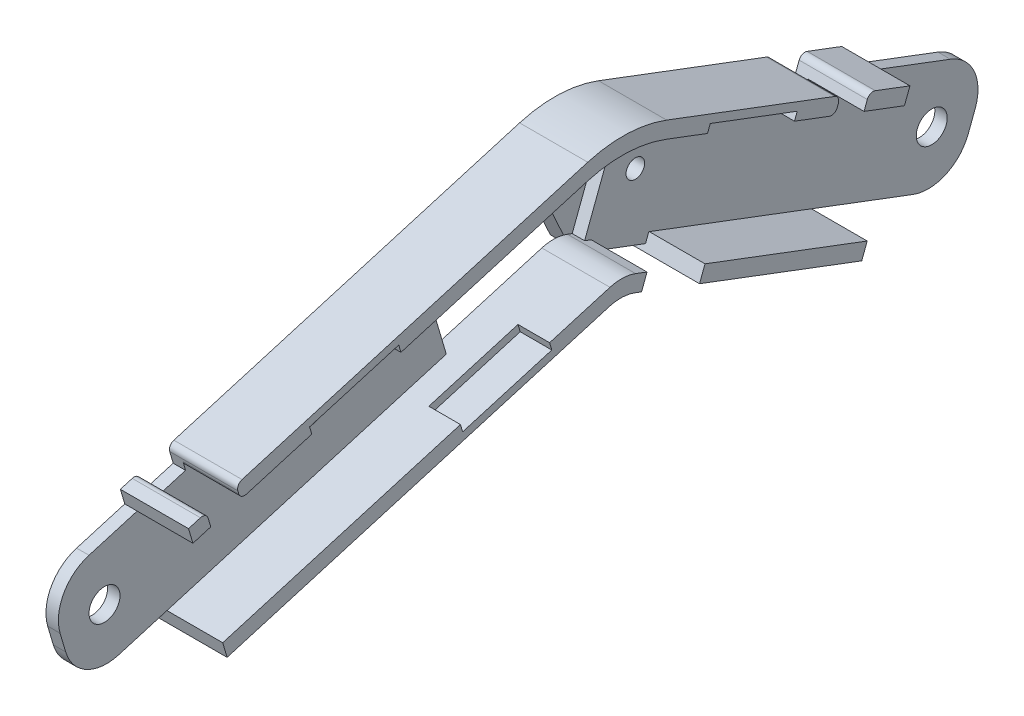
from build123d import *

# Parameters (mm, degrees)
SWEEP1_PROFILE_R        = 11
CUT_EXTRUDE1_DEPTH      = 139.5211963076765
CUT_EXTRUDE1_DEPTH_BACK = 139.5211963076765
BOSS_EXTRUDE1_DEPTH     = 11
BOSS_EXTRUDE4_DEPTH     = 11
SHELL1_START            = -11
SHELL1_DEPTH            = 11
SHELL1_START_2          = -113.150665538
SHELL1_2_DEPTH          = 47.855548818
SHELL1_START_3          = 20.420083618
SHELL1_3_DEPTH          = 73.048431747
FILLET1_R               = 6.5
BOSS_EXTRUDE2_DEPTH     = 3
CUT_EXTRUDE2_DEPTH      = 13.000000000000002
SKETCH21_R              = 2.499999999999935
SKETCH21_R_2            = 2.499999999999995
BOSS_EXTRUDE3_DEPTH     = 2
SKETCH22_R              = 1.4999999999999973
SKETCH22_R_2            = 1.5000000000000042
CUT_EXTRUDE3_DEPTH      = 13.000000000000002
FILLET2_R               = 3.75
CUT_EXTRUDE4_DEPTH      = 3
FILLET3_R               = 20
CUT_EXTRUDE5_DEPTH      = 3
FILLET4_R               = 1
CUT_EXTRUDE6_DEPTH      = 158.49217492446147
CUT_EXTRUDE7_DEPTH      = 5.1


with BuildPart() as part:
    # Sweep1: sweep along a path in Sketch6
    with BuildLine(Plane(origin=(0, 0, 0), x_dir=(0, 0, -1), z_dir=(1, 0, 0))) as sweep1_path:
        Line((17.67333262983066, 12.262734264551655), (84.99999999999999, 32.11621443102775))
        Line((84.99999999999999, 32.11621443102775), (127.09238599616681, 16.202979651458282))
    # Sweep1 profile (on start of the path) → Sweep1 (sweep)
    with BuildSketch(Plane(origin=(0, 12.262734264551655, -17.67333262983066), x_dir=(0, -0.9591665787285488, -0.28284178306991825), z_dir=(0, 0.28284178306991825, -0.9591665787285488))):
        Circle(SWEEP1_PROFILE_R)
    sweep(path=sweep1_path.line, transition=Transition.RIGHT)

    # Sketch13 → Cut-Extrude1 (cut, two sides: drawn at the far end of the back side and taken through both)
    with BuildSketch(Plane(origin=(0, 0, 0), x_dir=(1, 0, 0), z_dir=(0, 1, 0)).offset(-CUT_EXTRUDE1_DEPTH_BACK)):
        Polygon((-1.735e-14, 141.7207506217034), (-10.000000000000018, 141.7207506217034), (-10, -2.41e-15), (0, -1.18e-15), align=None)
    extrude(amount=CUT_EXTRUDE1_DEPTH + CUT_EXTRUDE1_DEPTH_BACK, mode=Mode.SUBTRACT)


with BuildPart() as cut_extrude1_piece_1:
    # of the separate pieces the step leaves, piece 1, a body of its own (cut_extrude1_pieces)
    add(part.part.solids().sort_by_distance((0, 22.813566631, -14.562073016))[0])



with BuildPart() as cut_extrude1_piece_2:
    # of the separate pieces the step leaves, piece 2, a body of its own (cut_extrude1_pieces)
    add(part.part.solids().sort_by_distance((-10, 7.867280813, -18.96947651))[0])


with BuildPart() as cut_extrude1_piece_1_1:
    add(cut_extrude1_piece_1.part)

    add(cut_extrude1_piece_2.part)  # Boss-Extrude1 merges Cut-Extrude1 piece 2
    # Sketch17 → Boss-Extrude1 (add)
    with BuildSketch(Plane(origin=(0, 0, 0), x_dir=(0, 0, -1), z_dir=(1, 0, 0))):
        Polygon((14.562073016061587, 22.813566630565735), (85.43326002077312, 43.71226488094253), (130.98228783117273, 26.4922295616324), (123.20248416116098, 5.91372974128417), (84.56673997922682, 20.52016398111302), (20.78459224359979, 1.7119018985376593), align=None)
    extrude(amount=-BOSS_EXTRUDE1_DEPTH)

    # Sketch24 → Boss-Extrude4 (add)
    with BuildSketch(Plane(origin=(0, 0, 0), x_dir=(0, 0, -1), z_dir=(1, 0, 0))):
        Polygon((127.09238599616687, 16.20297965145829), (84.99999999999997, 32.11621443102777), (17.673332629830696, 12.2627342645517), (14.5620730160616, 22.813566630565738), (85.43326002077312, 43.71226488094253), (130.98228783117273, 26.4922295616324), align=None)
    extrude(amount=BOSS_EXTRUDE4_DEPTH)

    # Shell1: read off the stored shape, not the designer's step
    # Shell1 outline → Shell1 (cut)
    with BuildSketch(Plane.YZ.offset(SHELL1_START)):
        Polygon((4.109818345, -20.077487786), (23.155629992, -84.665208166), (8.25219563, -124.08655276), (24.153763673, -130.098219232), (41.07679887, -85.334791834), (20.415650184, -15.269177474), align=None)
    extrude(amount=SHELL1_DEPTH, mode=Mode.SUBTRACT)

    # Shell1 2 outline → Shell1 2 (cut)
    with BuildSketch(Plane(origin=(0, 0, 0), x_dir=(1, 0, 0), z_dir=(0, 0.353627439545988, 0.935386355470374)).offset(SHELL1_START_2)):
        with BuildLine():
            ThreePointArc((0, 51.59940113), (6.01040764, 54.088993489), (8.5, 60.09940113))
            Line((8.5, 60.09940113), (8.5, 68.59940113))
            Line((8.5, 68.59940113), (0, 68.59940113))
            Line((0, 68.59940113), (0, 51.59940113))
        make_face()
    extrude(amount=SHELL1_2_DEPTH, mode=Mode.SUBTRACT)

    # Shell1 3 outline → Shell1 3 (cut)
    with BuildSketch(Plane(origin=(0, 0, 0), x_dir=(1, 0, 0), z_dir=(0, 0.2828417830699179, -0.9591665787285488)).offset(SHELL1_START_3)):
        with BuildLine():
            Line((8.5, -15.263247957), (8.5, -6.763247957))
            ThreePointArc((8.5, -6.763247957), (6.01040764, -0.752840317), (0, 1.736752043))
            Line((0, 1.736752043), (0, -15.263247957))
            Line((0, -15.263247957), (8.5, -15.263247957))
        make_face()
    extrude(amount=SHELL1_3_DEPTH, mode=Mode.SUBTRACT)

    # Fillet1
    fillet1_edges = [cut_extrude1_piece_1_1.edges().sort_by_distance(p)[0] for p in [
        (7.881335387835811, 24.026781093815067, -84.69775674305134),
        (6.090122796410721, 25.865288676138242, -84.76644839135132),
        (-5.5, 23.155629992, -84.665208166),
        (-5.5, 20.52016398111302, -84.56673997922682),
    ]]
    fillet(fillet1_edges, radius=FILLET1_R)

    # Sketch19 → Boss-Extrude2 (add)
    with BuildSketch(Plane(origin=(-11, 0, 0), x_dir=(0, 0, -1), z_dir=(1, 0, 0))):
        Polygon((23.326841994418306, 17.839501416273155), (61.69350514356026, 29.153172739069877), (63.814818516584644, 21.959423398605768), (25.44815536744269, 10.645752075809039), align=None)
        with BuildLine():
            Line((82.27394375020691, 30.863769892150234), (86.9487114072542, 20.688724856427108))
            Line((86.9487114072542, 20.688724856427108), (97.3098397387939, 16.771649028602706))
            Line((97.3098397387939, 16.771649028602706), (109.44211139391379, 26.082981771484846))
            Line((109.44211139391379, 26.082981771484846), (86.06088152658778, 34.92237140237257))
            ThreePointArc((86.06088152658778, 34.92237140237257), (82.80654161714303, 34.162852377504095), (82.27394375020691, 30.863769892150234))
        make_face()
    extrude(amount=-BOSS_EXTRUDE2_DEPTH)


with BuildPart() as boss_extrude2_piece_1:
    # of the separate pieces the step leaves, piece 1, a body of its own (boss_extrude2_pieces)
    add(cut_extrude1_piece_1_1.part.solids().sort_by_distance((-1e-09, 22.538001125, -82.570719291))[0])

    # Sketch20 → Cut-Extrude2 (cut)
    with BuildSketch(Plane(origin=(0, 45.92690987835062, -17.362895504685262), x_dir=(1, 0, 0), z_dir=(0, -0.9353863554703739, 0.3536274395459883))):
        Polygon((-11.00000000000001, -75.16519001409192), (3.999999999999988, -75.16519001409192), (3.9999999999999916, -85.1651900140919), (-11.00000000000001, -85.1651900140919), align=None)
    extrude(amount=-CUT_EXTRUDE2_DEPTH, mode=Mode.SUBTRACT)



with BuildPart() as boss_extrude2_piece_2:
    # of the separate pieces the step leaves, piece 2, a body of its own (boss_extrude2_pieces)
    add(cut_extrude1_piece_1_1.part.solids().sort_by_distance((-11, 17.839501416, -23.326841994))[0])


with BuildPart() as boss_extrude2_piece_1_1:
    add(boss_extrude2_piece_1.part)

    add(boss_extrude2_piece_2.part)  # Boss-Extrude3 merges Boss-Extrude2 piece 2
    # Sketch21 → Boss-Extrude3 (add)
    # profile 1 of 2: a face of its own
    with BuildSketch(Plane.ZY.offset(11)):
        with BuildLine():
            Line((-59.92574399937327, 35.14796385612329), (-14.844914799131477, 21.85440005183715))
            Line((-14.844914799131477, 21.85440005183715), (-15.269177473736278, 20.4156501837443))
            Line((-15.269177473736278, 20.4156501837443), (-7.49992818603503, 18.124631740877966))
            ThreePointArc((-7.49992818603503, 18.124631740877966), (-3.391731998282636, 14.806195907785265), (-2.833287095990472, 9.554774044468546))
            Line((-2.833287095990472, 9.554774044468546), (-3.738380801814209, 6.4854409925371845))
            ThreePointArc((-3.738380801814209, 6.4854409925371845), (-7.056816634906908, 2.377244804784792), (-12.308238498223627, 1.8187999024926287))
            Line((-12.308238498223627, 1.8187999024926287), (-20.07748778592488, 4.1098183453589545))
            Line((-20.07748778592488, 4.1098183453589545), (-20.501750460529845, 2.6710684772661613))
            Line((-20.501750460529845, 2.6710684772661613), (-65.58257966077163, 15.964632281552323))
            Line((-65.58257966077163, 15.964632281552323), (-59.92574399937327, 35.14796385612329))
        make_face()
        with Locations((-10.000000000002185, 9.999999999992289)):
            Circle(SKETCH21_R, mode=Mode.SUBTRACT)
    # profile 2 of 2: a face of its own
    with BuildSketch(Plane.ZY.offset(11)):
        with BuildLine():
            Line((-97.3098397387939, 16.771649028602706), (-97.8402808981129, 18.1747285618083))
            Line((-97.8402808981129, 18.1747285618083), (-140.4938987075619, 2.049317318511217))
            ThreePointArc((-140.4938987075619, 2.049317318511217), (-145.77235119424373, 2.21433744231316), (-149.3880938931748, 6.0634538383894725))
            Line((-149.3880938931748, 6.0634538383894725), (-150.519701699722, 9.056690175894678))
            ThreePointArc((-150.519701699722, 9.056690175894678), (-150.35468157592004, 14.33514266257649), (-146.50556517984373, 17.95088536150758))
            Line((-146.50556517984373, 17.95088536150758), (-103.85194737039468, 34.07629660480464))
            Line((-103.85194737039468, 34.07629660480464), (-104.38238852971367, 35.479376138010196))
            Line((-104.38238852971367, 35.479376138010196), (-94.02126019817398, 39.39645196583461))
            Line((-94.02126019817398, 39.39645196583461), (-86.9487114072542, 20.688724856427108))
            Line((-86.9487114072542, 20.688724856427108), (-97.3098397387939, 16.771649028602706))
        make_face()
        with Locations((-143.4999999999837, 10.000000000006171)):
            Circle(SKETCH21_R_2, mode=Mode.SUBTRACT)
    extrude(amount=-BOSS_EXTRUDE3_DEPTH)

    # Sketch22 → Cut-Extrude3 (cut)
    with BuildSketch(Plane.ZY.offset(13.999999999999998)):
        with Locations((-95.66554996848392, 28.084050497218655)):
            Circle(SKETCH22_R)
        with Locations((-43.57083025550148, 19.89946240743944)):
            Circle(SKETCH22_R_2)
    extrude(amount=-CUT_EXTRUDE3_DEPTH, mode=Mode.SUBTRACT)

    # Fillet2
    fillet2_edges = [boss_extrude2_piece_1_1.edges().sort_by_distance(p)[0] for p in [
        (-12.5, 10.645752075809039, -25.44815536744269),
        (-12.5, 17.839501416273155, -23.326841994418306),
        (-12.5, 21.959423398605768, -63.814818516584644),
        (-12.5, 29.153172739069877, -61.69350514356026),
        (-12.5, 26.082981771484846, -109.44211139391379),
    ]]
    fillet(fillet2_edges, radius=FILLET2_R - 0.0001)  # a hair under: the kernel refuses the full size

    # Sketch23 → Cut-Extrude4 (cut)
    with BuildSketch(Plane(origin=(0, 17.03791376961812, 5.024188725151693), x_dir=(1, 0, 0), z_dir=(0, 0.9591665787285488, 0.28284178306991814))):
        Polygon((-11, 23.42008361798458), (8, 23.42008361798471), (8, 28.420083617984712), (-11, 28.420083617984712), align=None)
    extrude(amount=-CUT_EXTRUDE4_DEPTH, mode=Mode.SUBTRACT)

    # Fillet3
    fillet3_edges = [boss_extrude2_piece_1_1.edges().sort_by_distance(p)[0] for p in [
        (0, 43.71226488094253, -85.43326002077312),
        (-5.5, 41.07679887, -85.334791834),
    ]]
    fillet(fillet3_edges, radius=FILLET3_R)

    # Sketch25 → Cut-Extrude5 (cut)
    with BuildSketch(Plane(origin=(0, 66.50540969869883, -25.142699174696986), x_dir=(1, 0, 0), z_dir=(0, 0.9353863554703739, -0.3536274395459882))):
        Polygon((-11, 101.17418781590268), (8, 101.17418781590271), (8, 106.17418781590271), (-11, 106.17418781590268), align=None)
    extrude(amount=-CUT_EXTRUDE5_DEPTH, mode=Mode.SUBTRACT)

    # Fillet4
    fillet4_edges = [boss_extrude2_piece_1_1.edges().sort_by_distance(p)[0] for p in [
        (-4.5, 22.678384448496875, -22.942510103507807),
        (-1.5, 23.66209197977548, -17.439572752247173),
        (8, 24.36919643745029, -19.837489199068607),
        (-1.5, 25.076300895125087, -22.235405645889983),
        (-4.5, 28.388974824561164, -118.89558538463223),
        (-1.5, 30.72744071321624, -119.77965398348931),
        (8, 29.84337211435127, -122.11811987216527),
        (-1.5, 28.959303515486297, -124.45658576084118),
    ]]
    fillet(fillet4_edges, radius=FILLET4_R)

    # Sketch26 → Cut-Extrude6 (cut, through all)
    with BuildSketch(Plane(origin=(0, 0, 0), x_dir=(0, 0, -1), z_dir=(1, 0, 0))):
        Polygon((-14.446633314427679, 64.99999999999999), (165.5533666855723, 65.00000000000001), (165.55336668557234, -24.99999999999997), (-14.446633314427677, -25.000000000000004), align=None)
    extrude(amount=CUT_EXTRUDE6_DEPTH, mode=Mode.SUBTRACT)

    # Sketch27 → Cut-Extrude7 (cut)
    with BuildSketch(Plane(origin=(0, 0, 0), x_dir=(0, 0, -1), z_dir=(1, 0, 0))):
        Polygon((34.45250904830736, 26.07248584514273), (34.09895681946996, 27.271444068553414), (48.486455500398186, 31.514070814602224), (48.840007729235595, 30.315112591191493), align=None)
        Polygon((58.44415093506696, 15.423489668155758), (58.79770316390435, 14.224531444745072), (73.1852018448326, 18.46715819079385), (72.8316496159952, 19.66611641420453), align=None)
        Polygon((98.3170855642761, 36.16877849455206), (98.75911986370858, 37.33801143889003), (112.78991519576418, 32.03359984570021), (112.34788089633173, 30.864366901362228), align=None)
    extrude(amount=-CUT_EXTRUDE7_DEPTH, mode=Mode.SUBTRACT)


solid = boss_extrude2_piece_1_1.part
